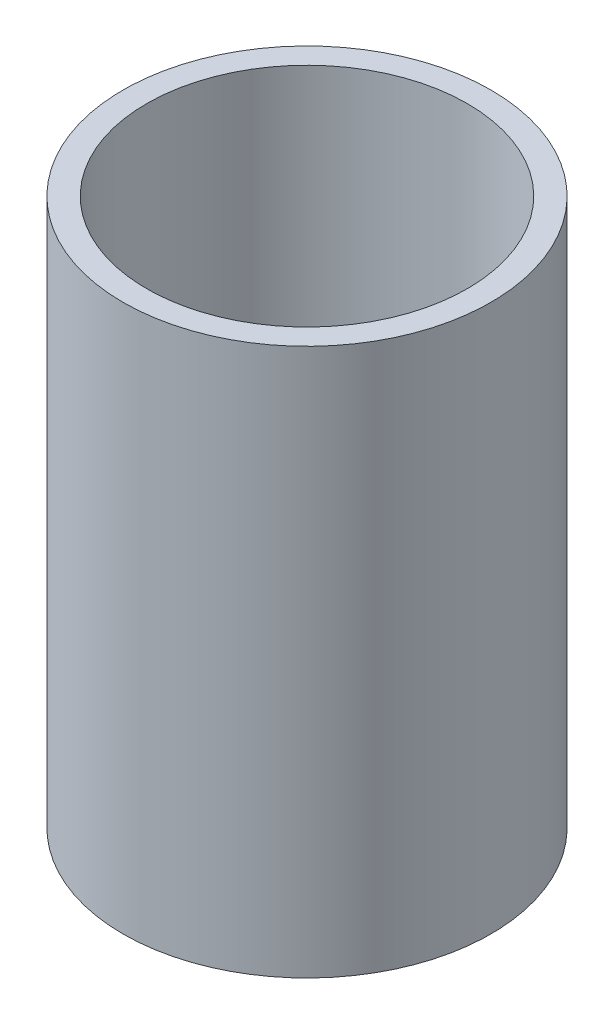
from build123d import *

# Parameters (mm, degrees)
SKETCH2_R           = 9.75
SKETCH2_R_2         = 8.5
BOSS_EXTRUDE1_DEPTH = 29


with BuildPart() as part:
    # Sketch2 → Boss-Extrude1 (new body)
    with BuildSketch(Plane(origin=(0, 0, 0), x_dir=(1, 0, 0), z_dir=(0, 1, 0))):
        Circle(SKETCH2_R)
        Circle(SKETCH2_R_2, mode=Mode.SUBTRACT)
    extrude(amount=BOSS_EXTRUDE1_DEPTH)


solid = part.part
